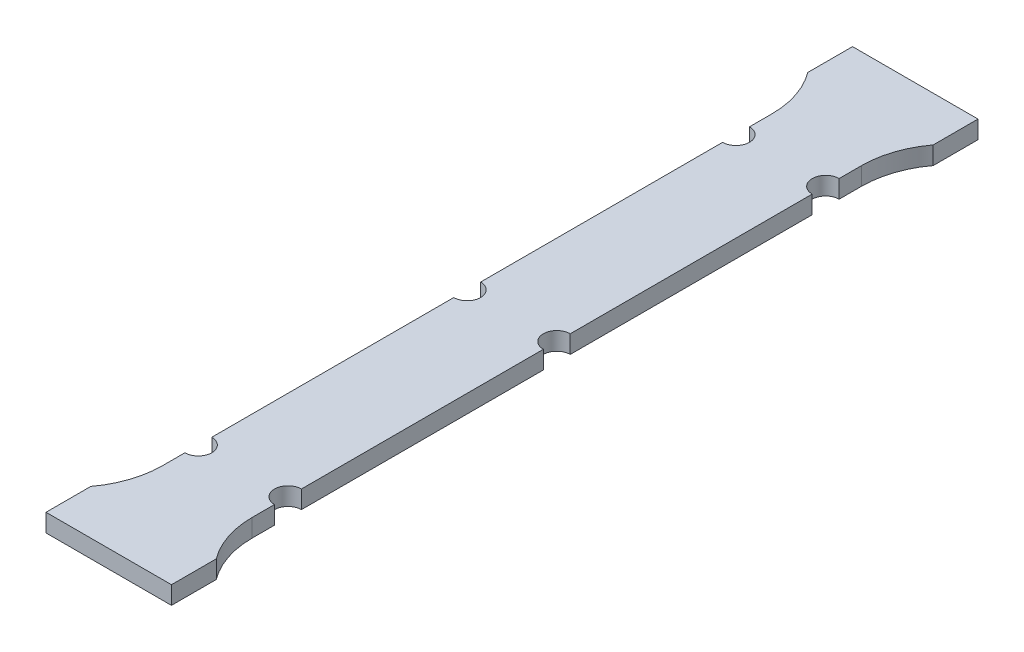
from build123d import *

# Parameters (mm, degrees)
SKETCH_1_W      = 2
SKETCH_1_H      = 5
EXTRUDE_1_DEPTH = 2
FILLET_1_R      = 10


with BuildPart() as part:
    # 草图1 → 凸台-拉伸1 (new body)
    with BuildSketch(Plane(origin=(0, 0, 0), x_dir=(1, 0, 0), z_dir=(0, 1, 0))):
        with BuildLine():
            Line((10, 0), (0, 0))
            Line((0, 0), (0, -5))
            Line((0, -5), (0, -13.5))
            ThreePointArc((0, -13.5), (1.060660172, -13.939339828), (1.5, -15))
            ThreePointArc((1.5, -15), (1.060660172, -16.060660172), (0, -16.5))
            Line((0, -16.5), (0, -43.5))
            ThreePointArc((0, -43.5), (1.060660172, -43.939339828), (1.5, -45))
            Line((1.5, -45), (2.5, -45))
            Line((2.5, -45), (2.5, -42.5))
            Line((2.5, -42.5), (7.5, -42.5))
            Line((7.5, -42.5), (7.5, -45))
            Line((7.5, -45), (8.5, -45))
            ThreePointArc((8.5, -45), (8.939339828, -43.939339828), (10, -43.5))
            Line((10, -43.5), (10, -16.5))
            ThreePointArc((10, -16.5), (8.5, -15), (10, -13.5))
            Line((10, -13.5), (10, -5))
            Line((10, -5), (10, 0))
        make_face()
        Polygon((2.5, -42.5), (2.5, -45), (5, -45), (7.5, -45), (7.5, -42.5), align=None)
        Polygon((5, -45), (2.5, -45), (2.5, -47.5), (7.5, -47.5), (7.5, -45), align=None)
        with BuildLine():
            Line((2.5, -45), (1.5, -45))
            ThreePointArc((1.5, -45), (1.060660172, -46.060660172), (0, -46.5))
            Line((0, -46.5), (0, -73.5))
            ThreePointArc((0, -73.5), (1.060660172, -73.939339828), (1.5, -75))
            ThreePointArc((1.5, -75), (1.060660172, -76.060660172), (0, -76.5))
            Line((0, -76.5), (0, -85))
            Line((0, -85), (0, -90))
            Line((0, -90), (10, -90))
            Line((10, -90), (10, -85))
            Line((10, -85), (10, -76.5))
            ThreePointArc((10, -76.5), (8.5, -75), (10, -73.5))
            Line((10, -73.5), (10, -46.5))
            ThreePointArc((10, -46.5), (8.939339828, -46.060660172), (8.5, -45))
            Line((8.5, -45), (7.5, -45))
            Line((7.5, -45), (7.5, -47.5))
            Line((7.5, -47.5), (2.5, -47.5))
            Line((2.5, -47.5), (2.5, -45))
        make_face()
        with Locations((11, -87.5)):
            Rectangle(SKETCH_1_W, SKETCH_1_H)
        with Locations((-1, -87.5)):
            Rectangle(SKETCH_1_W, SKETCH_1_H)
        with Locations((11, -2.5)):
            Rectangle(SKETCH_1_W, SKETCH_1_H)
        with Locations((-1, -2.5)):
            Rectangle(SKETCH_1_W, SKETCH_1_H)
    extrude(amount=EXTRUDE_1_DEPTH)

    # 圆角1
    # the kernel refuses this fillet: 10 mm, written as the material it adds along each edge
    with BuildSketch(Plane(origin=(10, 0, 85), x_dir=(0, 0, -1), z_dir=(0, 1, 0)), Plane(origin=(0, 0, 5), x_dir=(0, 0, 1), z_dir=(0, 1, 0))) as fillet_1_piece_1:
        with BuildLine():
            CenterArc((6, -10), FILLET_1_R, 90, 36.869897646)
            Line((0, -2), (0, 0))
            Line((0, 0), (6, 0))
        make_face()
    extrude(amount=2)
    with BuildSketch(Plane(origin=(0, 0, 85), x_dir=(-1, 0, 0), z_dir=(0, 1, 0)), Plane(origin=(10, 0, 5), x_dir=(1, 0, 0), z_dir=(0, 1, 0))) as fillet_1_piece_2:
        with BuildLine():
            CenterArc((10, -6), FILLET_1_R, 143.130102354, 36.869897646)
            Line((0, -6), (0, 0))
            Line((0, 0), (2, 0))
        make_face()
    extrude(amount=2)


solid = part.part
